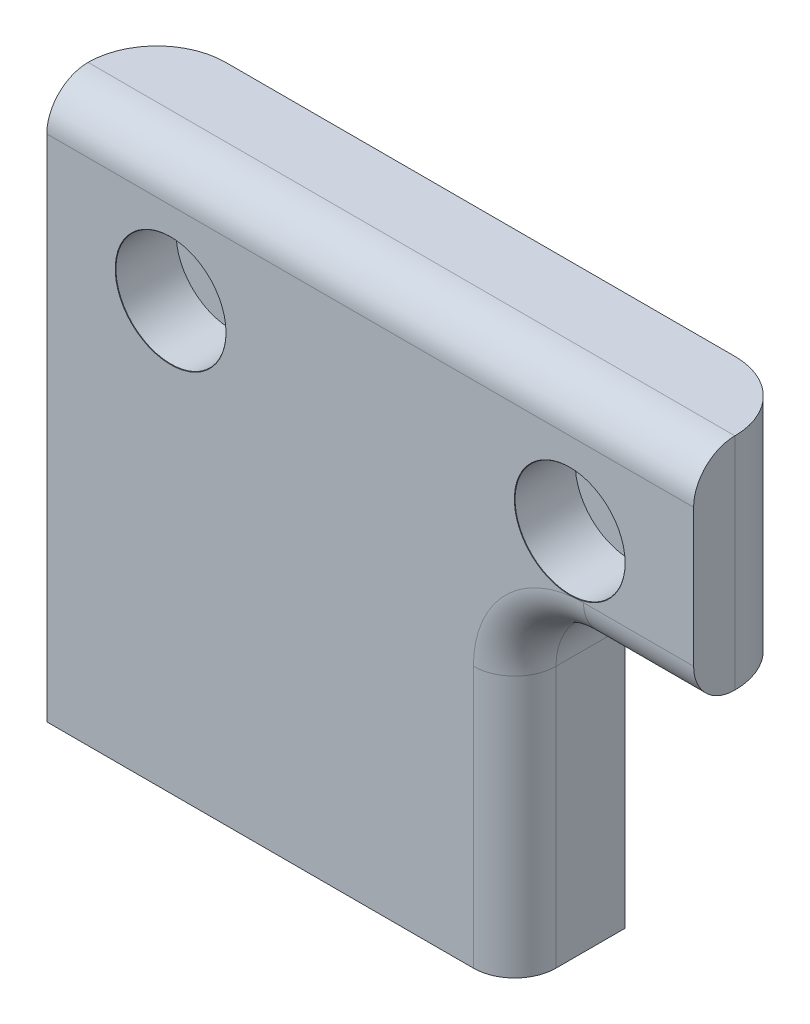
from build123d import *

# Parameters (mm, degrees)
SKETCH1_W                                    = 47
SKETCH1_H                                    = 8
BOSS_EXTRUDE1_DEPTH                          = 40
FILLET1_R                                    = 3
FILLET2_R                                    = 5
CBORE_FOR_M4_HEX_SOCKET_HEAD_CAP_SCR_2_COUNT = 2
CBORE_FOR_M4_HEX_SOCKET_HEAD_CAP_SCR_2_PITCH = 29
CUT_EXTRUDE1_REACH                           = 49.077
SKETCH5_W                                    = 13
SKETCH5_H                                    = 23.997787144
FILLET3_R                                    = 5
FILLET4_R                                    = 3


with BuildPart() as part:
    # Sketch1 → Boss-Extrude1 (new body)
    with BuildSketch(Plane(origin=(0, 0, 0), x_dir=(1, 0, 0), z_dir=(0, 1, 0))):
        Rectangle(SKETCH1_W, SKETCH1_H)
    extrude(amount=-BOSS_EXTRUDE1_DEPTH)

    # Fillet1
    fillet1_edges = [part.edges().sort_by_distance(p)[0] for p in [
        (0, 0, 4),
    ]]
    fillet(fillet1_edges, radius=FILLET1_R)

    # Fillet2
    fillet2_edges = [part.edges().sort_by_distance(p)[0] for p in [
        (-23.5, -20, -4),
        (23.5, -20, -4),
    ]]
    fillet(fillet2_edges, radius=FILLET2_R)

    # Sketch3 → CBORE for M4 Hex Socket Head Cap Screw1 (revolve, cut)
    with BuildSketch(Plane(origin=(-14.5, -9, 4), x_dir=(0, -1, 0), z_dir=(1, 0, 0))):
        Polygon((0, 0), (0, 8), (2.15, 8), (2.15, 4.4), (4, 4.4), (4, 0.025), (4.025, 0), align=None)
    cbore_for_m4_hex_socket_head_cap_screw1 = revolve(axis=Axis((-14.5, -9, 10.35), (0, 0, -1)), mode=Mode.SUBTRACT)

    # CBORE for M4 Hex Socket Head Cap Scr 2: CBORE for M4 Hex Socket Head Cap Screw1 ×2
    with Locations(*[(i * CBORE_FOR_M4_HEX_SOCKET_HEAD_CAP_SCR_2_PITCH, 0, 0) for i in range(1, CBORE_FOR_M4_HEX_SOCKET_HEAD_CAP_SCR_2_COUNT)]):
        add(cbore_for_m4_hex_socket_head_cap_screw1, mode=Mode.SUBTRACT)

    # Sketch5 → Cut-Extrude1 (cut, up to next)
    with BuildSketch(Plane.XY.offset(4), mode=Mode.PRIVATE) as cut_extrude1_sk1:
        with Locations((17, -28.001106428)):
            Rectangle(SKETCH5_W, SKETCH5_H)
    cut_extrude1_tool1 = extrude(cut_extrude1_sk1.sketch, amount=-CUT_EXTRUDE1_REACH, mode=Mode.PRIVATE) & part.part
    add(cut_extrude1_tool1.solids().sort_by_distance((17, -28.001106, 4))[0], mode=Mode.SUBTRACT)

    # Fillet3
    fillet3_edges = [part.edges().sort_by_distance(p)[0] for p in [
        (10.5, -16.002212856, 0),
    ]]
    fillet(fillet3_edges, radius=FILLET3_R)

    # Fillet4
    fillet4_edges = [part.edges().sort_by_distance(p)[0] for p in [
        (19.5, -16.002212856, 4),
        (11.964466094, -17.46667895, 4),
        (10.5, -30.501106428, 4),
    ]]
    fillet(fillet4_edges, radius=FILLET4_R)


solid = part.part
